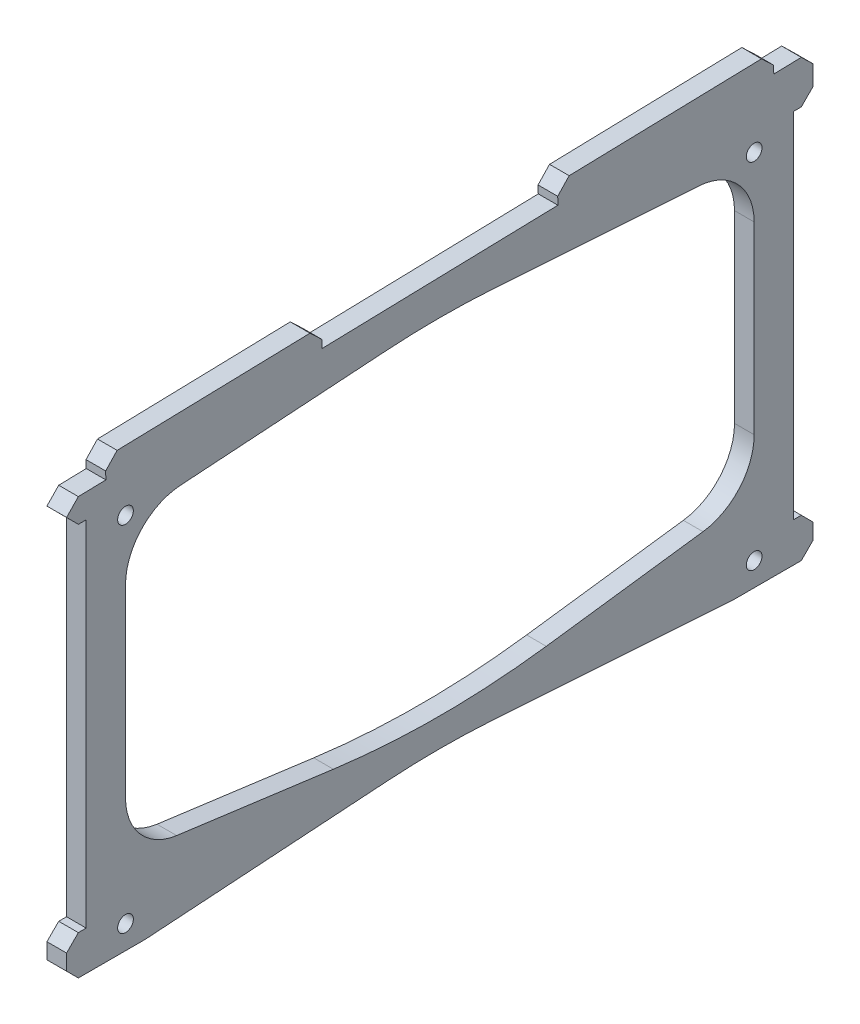
from build123d import *

# Parameters (mm, degrees)
SZKIC1_R                    = 2
DODANIE_WYCI_GNI_CIE1_DEPTH = 5


with BuildPart() as part:
    # Szkic1 → Dodanie-wyciągnięcie1 (new body)
    with BuildSketch(Plane(origin=(0, 0, 0), x_dir=(0, 0, -1), z_dir=(1, 0, 0))):
        with BuildLine():
            Line((-432.391937711, 109.703617644), (-432.444291608, 111.702932294))
            Line((-432.444291608, 111.702932294), (-429.523850478, 114.780435114))
            Line((-429.523850478, 114.780435114), (-380.446071806, 116.065581977))
            Line((-380.446071806, 116.065581977), (-377.368568986, 113.145140847))
            Line((-377.368568986, 113.145140847), (-377.316192656, 111.144969509))
            Line((-377.316192656, 111.144969509), (-317.336753158, 112.715586408))
            Line((-317.336753158, 112.715586408), (-317.389151921, 114.716614433))
            Line((-317.389151921, 114.716614433), (-314.46868848, 117.793260562))
            Line((-314.46868848, 117.793260562), (-265.521794427, 119.074980091))
            Line((-265.521794427, 119.074980091), (-262.444291608, 116.154538961))
            Line((-262.444291608, 116.154538961), (-262.391937711, 114.155224311))
            Line((-262.391937711, 114.155224311), (-255.390909686, 114.338552682))
            Line((-255.390909686, 114.338552682), (-252.391937711, 111.417083527))
            Line((-252.391937711, 111.417083527), (-252.391937711, 106.411081579))
            Line((-252.391937711, 106.411081579), (-255.391937711, 103.411081579))
            Line((-255.391937711, 103.411081579), (-257.391937711, 103.411081579))
            Line((-257.391937711, 103.411081579), (-257.391937711, 13.411081579))
            Line((-257.391937711, 13.411081579), (-255.391937711, 13.411081579))
            Line((-255.391937711, 13.411081579), (-252.391937711, 10.411081579))
            Line((-252.391937711, 10.411081579), (-252.391937711, 6.411081579))
            Line((-252.391937711, 6.411081579), (-255.391937711, 3.411081579))
            Line((-255.391937711, 3.411081579), (-272.391937711, 3.411081579))
            Line((-272.391937711, 3.411081579), (-334.088135606, 7.524161439))
            ThreePointArc((-334.088135606, 7.524161439), (-347.391937711, 7.967129868), (-360.695739816, 7.524161439))
            Line((-360.695739816, 7.524161439), (-422.391937711, 3.411081579))
            Line((-422.391937711, 3.411081579), (-439.391937711, 3.411081579))
            Line((-439.391937711, 3.411081579), (-442.391937711, 6.411081579))
            Line((-442.391937711, 6.411081579), (-442.391937711, 10.411081579))
            Line((-442.391937711, 10.411081579), (-439.391937711, 13.411081579))
            Line((-439.391937711, 13.411081579), (-437.391937711, 13.411081579))
            Line((-437.391937711, 13.411081579), (-437.391937711, 103.411081579))
            Line((-437.391937711, 103.411081579), (-439.391937711, 103.411081579))
            Line((-439.391937711, 103.411081579), (-442.391937711, 106.426420004))
            Line((-442.391937711, 106.426420004), (-439.392965736, 109.520289273))
            Line((-439.392965736, 109.520289273), (-432.391937711, 109.703617644))
        make_face()
        with Locations((-267.391937711, 9.411081579)):
            Circle(SZKIC1_R, mode=Mode.SUBTRACT)
        with Locations((-267.391937711, 99.411081579)):
            Circle(SZKIC1_R, mode=Mode.SUBTRACT)
        with Locations((-427.391937711, 9.411081579)):
            Circle(SZKIC1_R, mode=Mode.SUBTRACT)
        with Locations((-427.391937711, 99.411081579)):
            Circle(SZKIC1_R, mode=Mode.SUBTRACT)
        with BuildLine():
            Line((-427.391937711, 37.166245546), (-427.391937711, 84.05555066))
            ThreePointArc((-427.391937711, 84.05555066), (-423.345630635, 94.303311943), (-413.389722869, 99.022328028))
            Line((-413.389722869, 99.022328028), (-361.028334868, 102.513087228))
            ThreePointArc((-361.028334868, 102.513087228), (-347.391937711, 102.967129868), (-333.755540554, 102.513087228))
            Line((-333.755540554, 102.513087228), (-281.394152553, 99.022328028))
            ThreePointArc((-281.394152553, 99.022328028), (-271.438244786, 94.303311943), (-267.391937711, 84.05555066))
            Line((-267.391937711, 84.05555066), (-267.391937711, 37.166245546))
            ThreePointArc((-267.391937711, 37.166245546), (-271.106175951, 27.285376076), (-280.40948191, 22.297827036))
            Line((-280.40948191, 22.297827036), (-320.298375092, 16.979307945))
            ThreePointArc((-320.298375092, 16.979307945), (-347.391937711, 15.181027585), (-374.48550033, 16.979307945))
            Line((-374.48550033, 16.979307945), (-414.374393512, 22.297827036))
            ThreePointArc((-414.374393512, 22.297827036), (-423.677699471, 27.285376076), (-427.391937711, 37.166245546))
        make_face(mode=Mode.SUBTRACT)
    extrude(amount=DODANIE_WYCI_GNI_CIE1_DEPTH)


solid = part.part
